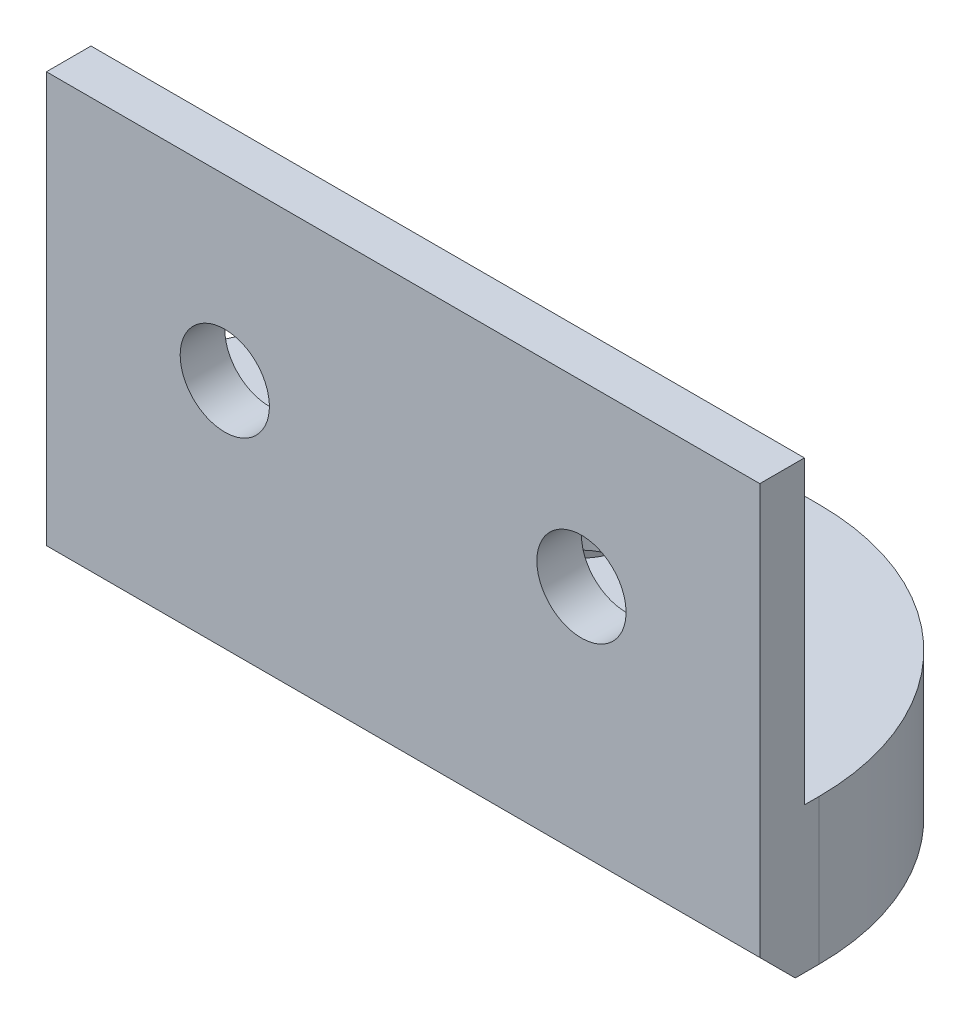
from build123d import *

# Parameters (mm, degrees)
SKETCH1_W                   = 50.8
SKETCH1_H                   = 25.4
BOSS_EXTRUDE1_DEPTH         = 3.175
F_1_4_0_25_DIAMETER_HOLE1_D = 6.35
SKETCH4_W                   = 50.8
SKETCH4_H                   = 6.35
SKETCH4_H_2                 = 4
BOSS_EXTRUDE2_DEPTH         = 19.05
CUT_EXTRUDE1_DEPTH          = 6.35
F_1_4_0_25_DIAMETER_HOLE2_D = 6.35
FILLET1_R                   = 18
CHAMFER1_SIZE               = 7


with BuildPart() as part:
    # Sketch1 → Boss-Extrude1 (new body)
    with BuildSketch(Plane.XY):
        Rectangle(SKETCH1_W, SKETCH1_H)
    extrude(amount=BOSS_EXTRUDE1_DEPTH)

    # 1/4 (0.25) Diameter Hole1 (through all)
    with Locations(Plane(origin=(0, 0, 0), x_dir=(-1, 0, 0), z_dir=(0, 0, -1))):
        with Locations((-12.7, 0), (12.7, 0)):
            Hole(F_1_4_0_25_DIAMETER_HOLE1_D / 2)

    # Sketch4 → Boss-Extrude2 (add)
    with BuildSketch(Plane(origin=(0, 0, 0), x_dir=(-1, 0, 0), z_dir=(0, 0, -1))):
        with Locations((0, -15.875)):
            Rectangle(SKETCH4_W, SKETCH4_H)
        with Locations((0, -10.7)):
            Rectangle(SKETCH4_W, SKETCH4_H_2)
    extrude(amount=BOSS_EXTRUDE2_DEPTH)

    # Sketch5 → Cut-Extrude1 (cut)
    with BuildSketch(Plane.XZ.offset(19.05)):
        Polygon((-3.299556788, -15.24), (3.299556788, -15.24), (6.599113577, -9.525), (3.299556788, -3.81), (-3.299556788, -3.81), (-6.599113577, -9.525), align=None)
    extrude(amount=-CUT_EXTRUDE1_DEPTH, mode=Mode.SUBTRACT)

    # 1/4 (0.25) Diameter Hole2 (through all)
    with Locations(Plane(origin=(0, -19.05, 0), x_dir=(-1, 0, 0), z_dir=(0, -1, 0))):
        with Locations((0, 9.525)):
            Hole(F_1_4_0_25_DIAMETER_HOLE2_D / 2)

    # Fillet1
    fillet1_edges = [part.edges().sort_by_distance(p)[0] for p in [
        (-25.4, -13.875, -19.05),
        (25.4, -13.875, -19.05),
    ]]
    fillet(fillet1_edges, radius=FILLET1_R)

    # Chamfer1
    # the kernel refuses this chamfer: 7 mm, written as the material it adds along each edge
    with BuildSketch(Plane(origin=(25.4, -12.7, 0), x_dir=(0, -0.9996219169112968, -0.02749587661058637), z_dir=(-1, 0, 0))) as chamfer1_piece_1_section:
        Polygon((CHAMFER1_SIZE * 0.999621916911, CHAMFER1_SIZE * 0.0274958766106), (-CHAMFER1_SIZE * 0.0274958766106, CHAMFER1_SIZE * 0.999621916911), (0, 0), align=None)
    chamfer1_piece_1 = extrude(amount=50.8, mode=Mode.PRIVATE)
    chamfer1_piece_1 = split(chamfer1_piece_1, bisect_by=Plane(origin=(0, -19.05, 1.366790838), z_dir=(0, 1, 0)), keep=Keep.TOP, mode=Mode.PRIVATE)
    chamfer1_piece_1 = split(chamfer1_piece_1, bisect_by=Plane(origin=(0, -15.42419562, 3.175), z_dir=(0, 0, -1)), keep=Keep.TOP, mode=Mode.PRIVATE)
    add(chamfer1_piece_1)


solid = part.part
